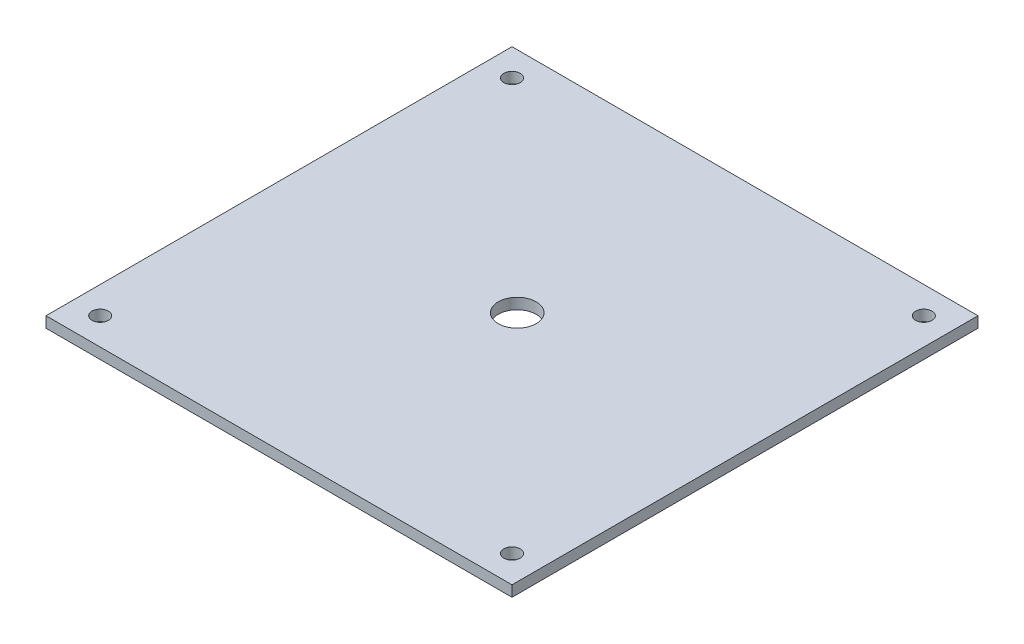
from build123d import *

# Parameters (mm, degrees)
SKETCH1_W           = 273.05
SKETCH1_H           = 273.05
SKETCH1_R           = 11.1125
BOSS_EXTRUDE1_DEPTH = 6.35
SKETCH2_R           = 4.7625
CUT_EXTRUDE1_DEPTH  = 194.179899964


with BuildPart() as part:
    # Sketch1 → Boss-Extrude1 (new body)
    with BuildSketch(Plane(origin=(0, 0, 0), x_dir=(1, 0, 0), z_dir=(0, 1, 0))):
        Rectangle(SKETCH1_W, SKETCH1_H)
        with Locations((0, 3.048)):
            Circle(SKETCH1_R, mode=Mode.SUBTRACT)
    extrude(amount=BOSS_EXTRUDE1_DEPTH)

    # Sketch2 → Cut-Extrude1 (cut, through all)
    with BuildSketch(Plane(origin=(0, 6.35, 0), x_dir=(-1, 0, 0), z_dir=(0, 1, 0))):
        with Locations((120.65, -120.65)):
            Circle(SKETCH2_R)
        with Locations((120.65, 120.65)):
            Circle(SKETCH2_R)
        with Locations((-120.65, -120.65)):
            Circle(SKETCH2_R)
        with Locations((-120.65, 120.65)):
            Circle(SKETCH2_R)
    extrude(amount=-CUT_EXTRUDE1_DEPTH, mode=Mode.SUBTRACT)


solid = part.part
